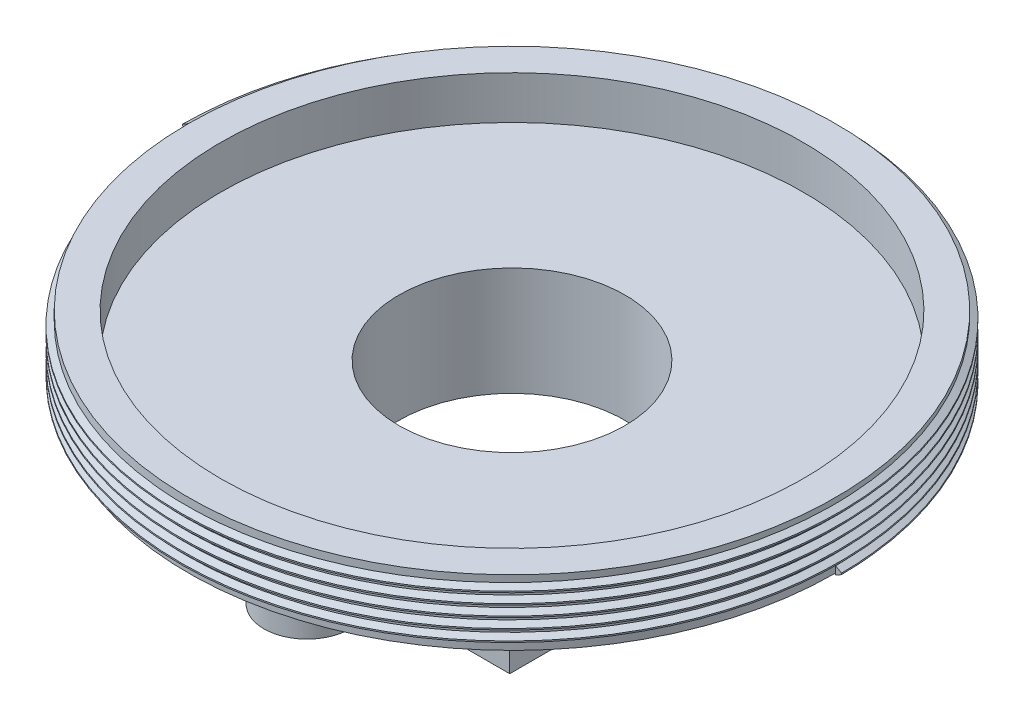
from build123d import *

# Parameters (mm, degrees)
SKETCH1_R             = 5.25
SKETCH1_R_2           = 1.1
BASE_DEPTH            = 4
MIDDLE_START          = 1.04
SKETCH1_3_R           = 13.519
SKETCH1_3_R_2         = 5.25
SKETCH1_3_R_3         = 1.1
MIDDLE_HOLDER_DEPTH   = 1.04
OUTSIDE_START         = 3.04
SKETCH1_4_R           = 15.0225
SKETCH1_4_R_2         = 13.519
OUTSIDE_HOLDER_DEPTH  = 3.04
THREAD1_PITCH         = 0.5
FILLET1_R             = 1
FILLET2_R             = 1
M2_TAPPED_HOLE1_D     = 1.6
M2_TAPPED_HOLE1_DEPTH = 4
M2_TAPPED_HOLE1_TIP   = 0.480688495


with BuildPart() as part:
    # Sketch1 → Base (new body)
    # profile 1 of 3: a face of its own
    with BuildSketch(Plane(origin=(0, 0, 0), x_dir=(1, 0, 0), z_dir=(0, 1, 0))):
        with BuildLine():
            Line((-2, -9.511976124), (-1.993783133, -7.611976124))
            Line((-1.993783133, -7.611976124), (-7.493783133, -7.611976124))
            Line((-7.493783133, -7.611976124), (-7.493783133, 7.588023876))
            Line((-7.493783133, 7.588023876), (-2, 7.588023876))
            Line((-2, 7.588023876), (-2, 9.488023876))
            ThreePointArc((-2, 9.488023876), (0, 11.488023876), (2, 9.488023876))
            Line((2, 9.488023876), (2, 7.588023876))
            Line((2, 7.588023876), (7.506216867, 7.588023876))
            Line((7.506216867, 7.588023876), (7.506216867, -7.611976124))
            Line((7.506216867, -7.611976124), (2, -7.611976124))
            Line((2, -7.611976124), (2, -9.511976124))
            ThreePointArc((2, -9.511976124), (0, -11.511976124), (-2, -9.511976124))
        make_face()
        with Locations(Location((0, 0, 0), (0, 0, 270))):
            Circle(SKETCH1_R, mode=Mode.SUBTRACT)
        with Locations((0, 9.488023876)):
            Circle(SKETCH1_R_2, mode=Mode.SUBTRACT)
        with Locations((0, -9.511976124)):
            Circle(SKETCH1_R_2, mode=Mode.SUBTRACT)
    # profile 2 of 3: a face of its own
    with BuildSketch(Plane(origin=(0, 0, 0), x_dir=(1, 0, 0), z_dir=(0, 1, 0))):
        with Locations((0, 9.488023876)):
            Circle(SKETCH1_R_2)
    # profile 3 of 3: a face of its own
    with BuildSketch(Plane(origin=(0, 0, 0), x_dir=(1, 0, 0), z_dir=(0, 1, 0))):
        with Locations((0, -9.511976124)):
            Circle(SKETCH1_R_2)
    extrude(amount=-BASE_DEPTH)

    # Sketch1<3> → Middle Holder (add)
    # profile 1 of 4: a face of its own
    with BuildSketch(Plane(origin=(0, 0, 0), x_dir=(1, 0, 0), z_dir=(0, 1, 0)).offset(MIDDLE_START)):
        with Locations(Location((0, 0, 0), (0, 0, 270))):
            Circle(SKETCH1_3_R)
        with BuildLine():
            ThreePointArc((-2, -9.511976124), (0, -11.511976124), (2, -9.511976124))
            Line((2, -9.511976124), (2, -7.611976124))
            Line((2, -7.611976124), (7.506216867, -7.611976124))
            Line((7.506216867, -7.611976124), (7.506216867, 7.588023876))
            Line((7.506216867, 7.588023876), (2, 7.588023876))
            Line((2, 7.588023876), (2, 9.488023876))
            ThreePointArc((2, 9.488023876), (0, 11.488023876), (-2, 9.488023876))
            Line((-2, 9.488023876), (-2, 7.588023876))
            Line((-2, 7.588023876), (-7.493783133, 7.588023876))
            Line((-7.493783133, 7.588023876), (-7.493783133, -7.611976124))
            Line((-7.493783133, -7.611976124), (-1.993783133, -7.611976124))
            Line((-1.993783133, -7.611976124), (-2, -9.511976124))
        make_face(mode=Mode.SUBTRACT)
    # profile 2 of 4: a face of its own
    with BuildSketch(Plane(origin=(0, 0, 0), x_dir=(1, 0, 0), z_dir=(0, 1, 0)).offset(MIDDLE_START)):
        with BuildLine():
            Line((-2, -9.511976124), (-1.993783133, -7.611976124))
            Line((-1.993783133, -7.611976124), (-7.493783133, -7.611976124))
            Line((-7.493783133, -7.611976124), (-7.493783133, 7.588023876))
            Line((-7.493783133, 7.588023876), (-2, 7.588023876))
            Line((-2, 7.588023876), (-2, 9.488023876))
            ThreePointArc((-2, 9.488023876), (0, 11.488023876), (2, 9.488023876))
            Line((2, 9.488023876), (2, 7.588023876))
            Line((2, 7.588023876), (7.506216867, 7.588023876))
            Line((7.506216867, 7.588023876), (7.506216867, -7.611976124))
            Line((7.506216867, -7.611976124), (2, -7.611976124))
            Line((2, -7.611976124), (2, -9.511976124))
            ThreePointArc((2, -9.511976124), (0, -11.511976124), (-2, -9.511976124))
        make_face()
        with Locations(Location((0, 0, 0), (0, 0, 270))):
            Circle(SKETCH1_3_R_2, mode=Mode.SUBTRACT)
        with Locations((0, 9.488023876)):
            Circle(SKETCH1_3_R_3, mode=Mode.SUBTRACT)
        with Locations((0, -9.511976124)):
            Circle(SKETCH1_3_R_3, mode=Mode.SUBTRACT)
    # profile 3 of 4: a face of its own
    with BuildSketch(Plane(origin=(0, 0, 0), x_dir=(1, 0, 0), z_dir=(0, 1, 0)).offset(MIDDLE_START)):
        with Locations((0, -9.511976124)):
            Circle(SKETCH1_3_R_3)
    # profile 4 of 4: a face of its own
    with BuildSketch(Plane(origin=(0, 0, 0), x_dir=(1, 0, 0), z_dir=(0, 1, 0)).offset(MIDDLE_START)):
        with Locations((0, 9.488023876)):
            Circle(SKETCH1_3_R_3)
    extrude(amount=-MIDDLE_HOLDER_DEPTH)

    # Sketch1<4> → Outside Holder (add)
    with BuildSketch(Plane(origin=(0, 0, 0), x_dir=(1, 0, 0), z_dir=(0, 1, 0)).offset(OUTSIDE_START)):
        with Locations(Location((0, 0, 0), (0, 0, 270))):
            Circle(SKETCH1_4_R)
        with Locations(Location((0, 0, 0), (0, 0, 270))):
            Circle(SKETCH1_4_R_2, mode=Mode.SUBTRACT)
    extrude(amount=-OUTSIDE_HOLDER_DEPTH)

    # Thread1: the profile of Thread Profile1 profile screwed along a right-hand helix of 5.5 turns, 6 arcs to a turn; built about Z, then put on its axis
    thread1_z = Axis((0, 0, 0), (0, 0, 1))
    thread1_corners = [(15.0222, 0, -0.000173205), (15.293132938, 0, 0.156249999), (15.293132938, 0, 0.218749999), (15.0222, 0, 0.375173204)]
    with BuildLine(mode=Mode.PRIVATE) as thread1_profile:
        Line(thread1_corners[0], thread1_corners[1])
        Line(thread1_corners[1], thread1_corners[2])
        Line(thread1_corners[2], thread1_corners[3])
        Line(thread1_corners[3], thread1_corners[0])
    thread1_cap = Face(thread1_profile.wire())
    thread1_turn_angles = [0, 30, 60, 90, 120, 150, 180, 210, 240, 270, 300, 330, 360]
    thread1_turn_weights = [1, 0.8660254037844387, 1, 0.8660254037844387, 1, 0.8660254037844387, 1, 0.8660254037844387, 1, 0.8660254037844387, 1, 0.8660254037844387, 1]
    thread1_turn_rails = [Edge.make_bspline([Vector(p[0], p[1], 0).rotate(thread1_z, thread1_turn_angles[k]) / thread1_turn_weights[k] + Vector(0, 0, p[2] + THREAD1_PITCH * thread1_turn_angles[k] / 360) for k in range(13)], [0, 0, 0, 1, 1, 2, 2, 3, 3, 4, 4, 5, 5, 6, 6, 6], 2, thread1_turn_weights) for p in thread1_corners]
    thread1_turn_sides = [Face.make_surface_from_curves(thread1_turn_rails[p[0]], thread1_turn_rails[p[1]]) for p in [(0, 1), (1, 2), (2, 3), (3, 0)]]
    thread1_last_angles = [1800, 1830, 1860, 1890, 1920, 1950, 1980]
    thread1_last_weights = [1, 0.8660254037844387, 1, 0.8660254037844387, 1, 0.8660254037844387, 1]
    thread1_last_rails = [Edge.make_bspline([Vector(p[0], p[1], 0).rotate(thread1_z, thread1_last_angles[k]) / thread1_last_weights[k] + Vector(0, 0, p[2] + THREAD1_PITCH * thread1_last_angles[k] / 360) for k in range(7)], [0, 0, 0, 1, 1, 2, 2, 3, 3, 3], 2, thread1_last_weights) for p in thread1_corners]
    thread1_last_sides = [Face.make_surface_from_curves(thread1_last_rails[p[0]], thread1_last_rails[p[1]]) for p in [(0, 1), (1, 2), (2, 3), (3, 0)]]
    thread1 = Plane(origin=(0, 3.04, 0), x_dir=(-1, 0, 0), z_dir=(0, -1, 0)) * Solid(Shell([*[p.moved(Location((0, 0, THREAD1_PITCH * i))) for i in range(5) for p in thread1_turn_sides], *thread1_last_sides, thread1_cap, thread1_cap.rotate(thread1_z, 1980).moved(Location((0, 0, THREAD1_PITCH * 1980 / 360)))]))
    add(thread1)

    # Fillet1
    fillet1_edges = [part.edges().sort_by_distance(p)[0] for p in [
        (-7.493783133, 0, 0.011976124),
    ]]
    fillet(fillet1_edges, radius=FILLET1_R)

    # Fillet2
    fillet2_edges = [part.edges().sort_by_distance(p)[0] for p in [
        (7.506216867, 0, 0.011976124),
    ]]
    fillet(fillet2_edges, radius=FILLET2_R)

    # M2 Tapped Hole1
    with Locations(Plane(origin=(0, -4, 0), x_dir=(-1, 0, 0), z_dir=(0, -1, 0))):
        with Locations((0, 9.488023876), (0, -9.511976124)):
            Hole(M2_TAPPED_HOLE1_D / 2, depth=M2_TAPPED_HOLE1_DEPTH)
            with Locations((0, 0, -(M2_TAPPED_HOLE1_DEPTH + M2_TAPPED_HOLE1_TIP / 2))):  # 118° drill point
                Cone(0, M2_TAPPED_HOLE1_D / 2, M2_TAPPED_HOLE1_TIP, mode=Mode.SUBTRACT)


solid = part.part
